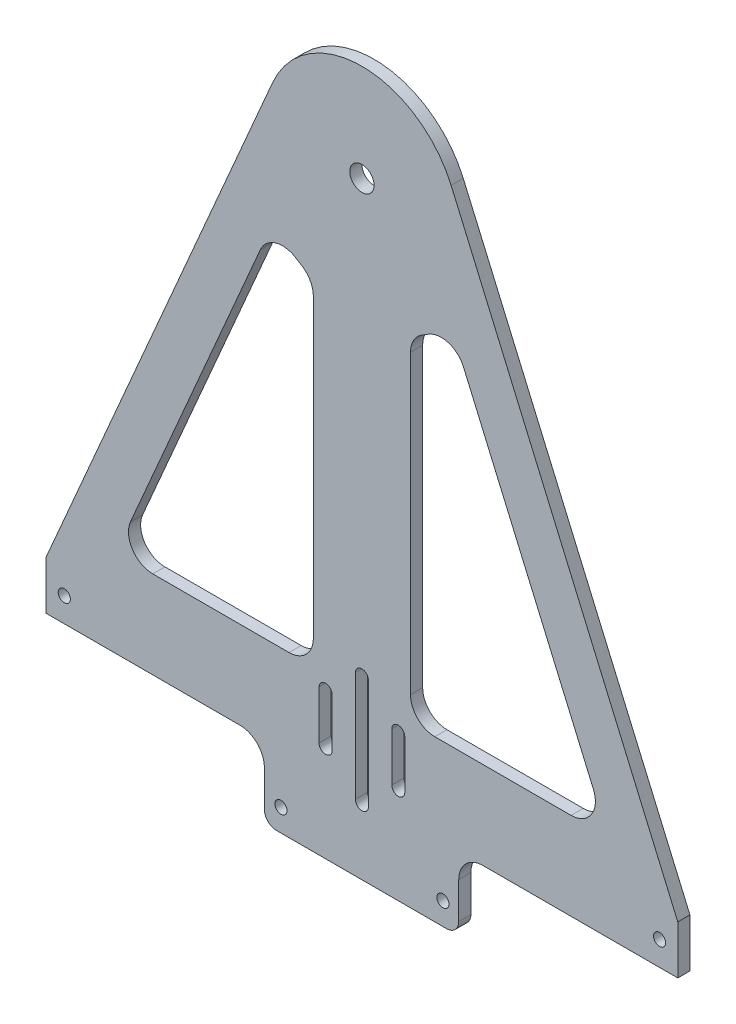
from build123d import *

# Parameters (mm, degrees)
SKETCH5_R           = 1.5875
SKETCH5_R_2         = 3.175
BOSS_EXTRUDE2_DEPTH = 3.175


with BuildPart() as part:
    # Sketch5 → Boss-Extrude2 (new body)
    with BuildSketch(Plane.XY):
        with BuildLine():
            Line((-82.55, 70.885609673), (-82.55, 58.185609673))
            Line((-82.55, 58.185609673), (-31.848963051, 58.185609673))
            ThreePointArc((-31.848963051, 58.185609673), (-27.35883499, 56.325737733), (-25.498963051, 51.835609673))
            Line((-25.498963051, 51.835609673), (-25.498963051, 42.310609673))
            ThreePointArc((-25.498963051, 42.310609673), (-24.569027081, 40.065545642), (-22.323963051, 39.135609673))
            Line((-22.323963051, 39.135609673), (22.126036949, 39.135609673))
            ThreePointArc((22.126036949, 39.135609673), (24.37110098, 40.065545642), (25.301036949, 42.310609673))
            Line((25.301036949, 42.310609673), (25.301036949, 51.835609673))
            ThreePointArc((25.301036949, 51.835609673), (27.160908889, 56.325737733), (31.651036949, 58.185609673))
            Line((31.651036949, 58.185609673), (82.55, 58.185609673))
            Line((82.55, 58.185609673), (82.55, 70.885609673))
            Line((82.55, 70.885609673), (23.316175101, 207.961123488))
            ThreePointArc((23.316175101, 207.961123488), (0, 223.285609673), (-23.316175101, 207.961123488))
            Line((-23.316175101, 207.961123488), (-82.55, 70.885609673))
        make_face()
        with Locations((-77.7875, 64.535609673)):
            Circle(SKETCH5_R, mode=Mode.SUBTRACT)
        with Locations((77.7875, 64.535609673)):
            Circle(SKETCH5_R, mode=Mode.SUBTRACT)
        with Locations((-21.166666667, 44.968966307)):
            Circle(SKETCH5_R, mode=Mode.SUBTRACT)
        with Locations((21.166666667, 44.968966307)):
            Circle(SKETCH5_R, mode=Mode.SUBTRACT)
        with Locations((0, 197.885609673)):
            Circle(SKETCH5_R_2, mode=Mode.SUBTRACT)
        with BuildLine():
            Line((-60.492105619, 89.914488127), (-26.559973448, 168.438278547))
            ThreePointArc((-26.559973448, 168.438278547), (-22.569736053, 171.997334865), (-17.275774727, 171.24710169))
            ThreePointArc((-17.275774727, 171.24710169), (-16.580935464, 170.809142415), (-15.875, 170.389303103))
            ThreePointArc((-15.875, 170.389303103), (-13.550738686, 168.065041789), (-12.7, 164.890041789))
            Line((-12.7, 164.890041789), (-12.7, 87.395609673))
            ThreePointArc((-12.7, 87.395609673), (-14.559871939, 82.905481612), (-19.05, 81.045609673))
            Line((-19.05, 81.045609673), (-54.663061843, 81.045609673))
            ThreePointArc((-54.663061843, 81.045609673), (-59.96953799, 83.907944134), (-60.492105619, 89.914488127))
        make_face(mode=Mode.SUBTRACT)
        with BuildLine():
            Line((60.492105619, 89.914488127), (26.559973448, 168.438278547))
            ThreePointArc((26.559973448, 168.438278547), (22.569736053, 171.997334865), (17.275774727, 171.24710169))
            ThreePointArc((17.275774727, 171.24710169), (16.580935464, 170.809142415), (15.875, 170.389303103))
            ThreePointArc((15.875, 170.389303103), (13.550738686, 168.065041789), (12.7, 164.890041789))
            Line((12.7, 164.890041789), (12.7, 87.395609673))
            ThreePointArc((12.7, 87.395609673), (14.559871939, 82.905481612), (19.05, 81.045609673))
            Line((19.05, 81.045609673), (54.663061843, 81.045609673))
            ThreePointArc((54.663061843, 81.045609673), (59.96953799, 83.907944134), (60.492105619, 89.914488127))
        make_face(mode=Mode.SUBTRACT)
        with BuildLine():
            Line((-11.2, 64.474125728), (-11.2, 77.174125728))
            ThreePointArc((-11.2, 77.174125728), (-9.5, 78.874125728), (-7.8, 77.174125728))
            Line((-7.8, 77.174125728), (-7.8, 64.474125728))
            ThreePointArc((-7.8, 64.474125728), (-9.5, 62.774125728), (-11.2, 64.474125728))
        make_face(mode=Mode.SUBTRACT)
        with BuildLine():
            Line((-1.7, 56.474125728), (-1.7, 85.174125728))
            ThreePointArc((-1.7, 85.174125728), (0, 86.874125728), (1.7, 85.174125728))
            Line((1.7, 85.174125728), (1.7, 56.474125728))
            ThreePointArc((1.7, 56.474125728), (0, 54.774125728), (-1.7, 56.474125728))
        make_face(mode=Mode.SUBTRACT)
        with BuildLine():
            Line((7.8, 64.474125728), (7.8, 77.174125728))
            ThreePointArc((7.8, 77.174125728), (9.5, 78.874125728), (11.2, 77.174125728))
            Line((11.2, 77.174125728), (11.2, 64.474125728))
            ThreePointArc((11.2, 64.474125728), (9.5, 62.774125728), (7.8, 64.474125728))
        make_face(mode=Mode.SUBTRACT)
    extrude(amount=BOSS_EXTRUDE2_DEPTH)


solid = part.part
